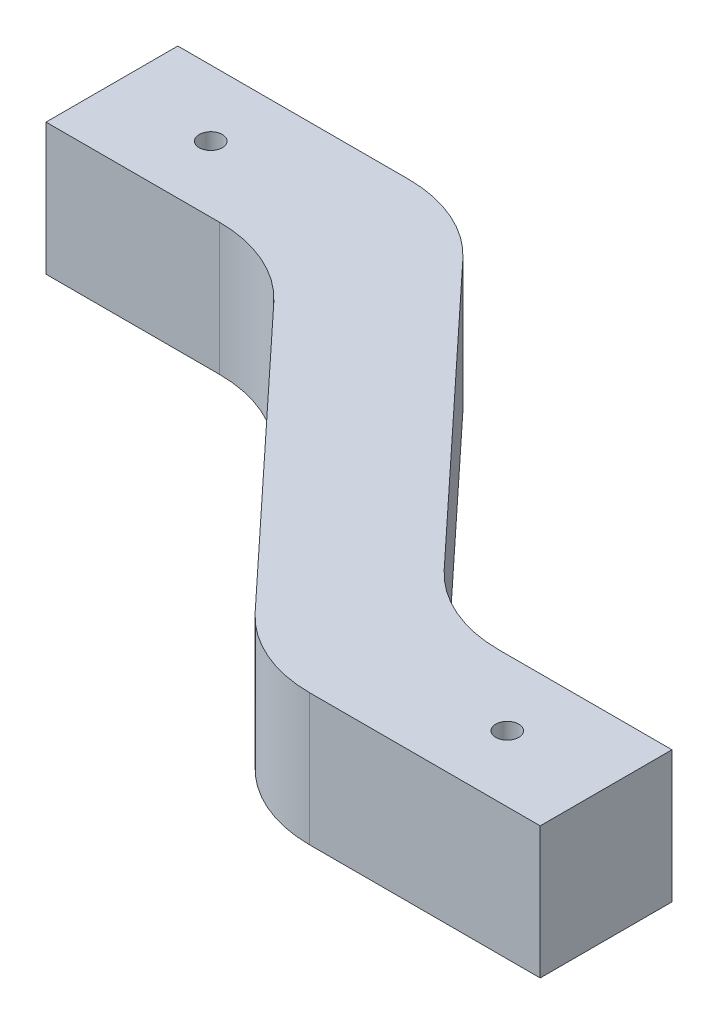
from build123d import *

# Parameters (mm, degrees)
CROQUIS1_R              = 1.75
SALIENTE_EXTRUIR1_DEPTH = 20
REDONDEO1_R             = 20


with BuildPart() as part:
    # Croquis1 → Saliente-Extruir1 (new body)
    with BuildSketch(Plane(origin=(0, 0, 0), x_dir=(1, 0, 0), z_dir=(0, 1, 0))):
        Polygon((-65, 0), (-21.305768696, 0), (30, -55), (65, -55), (65, -75), (21.305768696, -75), (-30, -20), (-65, -20), align=None)
        with Locations((-50, -10)):
            Circle(CROQUIS1_R, mode=Mode.SUBTRACT)
        with Locations((50, -65)):
            Circle(CROQUIS1_R, mode=Mode.SUBTRACT)
    extrude(amount=SALIENTE_EXTRUIR1_DEPTH)

    # Redondeo1
    redondeo1_edges = [part.edges().sort_by_distance(p)[0] for p in [
        (21.305768696, 10, 75),
        (30, 10, 55),
        (-21.305768696, 10, 0),
        (-30, 10, 20),
    ]]
    fillet(redondeo1_edges, radius=REDONDEO1_R)


solid = part.part
